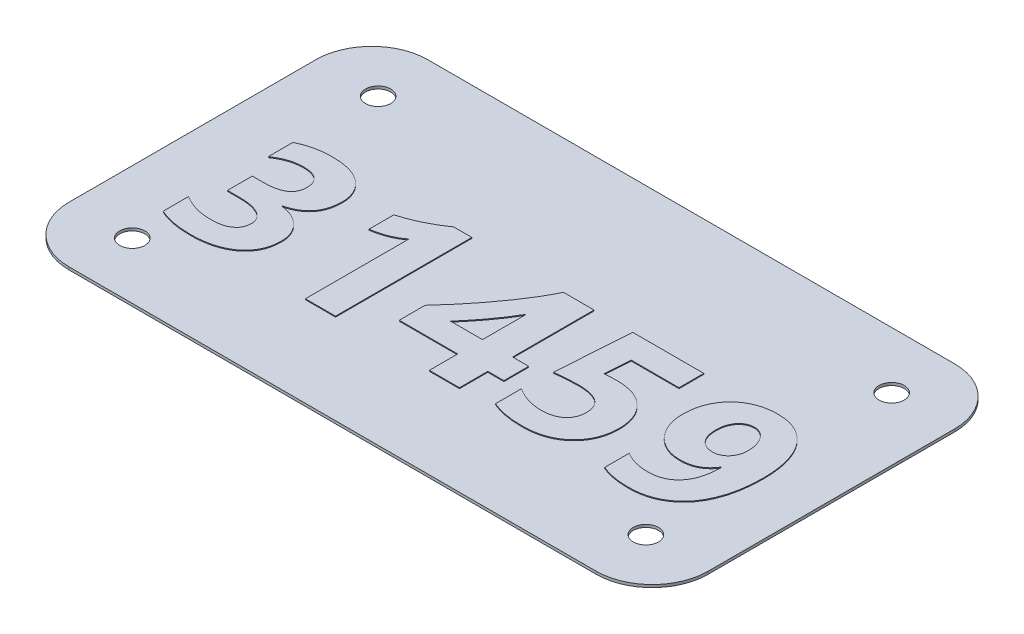
from build123d import *

# Parameters (mm, degrees)
SKETCH1_W               = 180.975
SKETCH1_H               = 101.6
BOSS_EXTRUDE1_DEPTH     = 0.762
F_1_4_CLEARANCE_HOLE1_D = 7.14248
FILLET1_R               = 15.875
BOSS_EXTRUDE2_DEPTH     = 0.254


with BuildPart() as part:
    # Sketch1 → Boss-Extrude1 (new body)
    with BuildSketch(Plane(origin=(0, 0, 0), x_dir=(1, 0, 0), z_dir=(0, 1, 0))):
        Rectangle(SKETCH1_W, SKETCH1_H)
    extrude(amount=BOSS_EXTRUDE1_DEPTH)

    # 1/4 Clearance Hole1 (through all)
    with Locations(Plane(origin=(0, 0.762, 0), x_dir=(1, 0, 0), z_dir=(0, 1, 0))):
        with Locations((-72.7075, 34.798), (72.7075, 34.798), (-72.7075, -34.798), (72.7075, -34.798)):
            Hole(F_1_4_CLEARANCE_HOLE1_D / 2)

    # Fillet1
    fillet1_edges = [part.edges().sort_by_distance(p)[0] for p in [
        (90.4875, 0.381, 50.8),
        (-90.4875, 0.381, 50.8),
        (90.4875, 0.381, -50.8),
        (-90.4875, 0.381, -50.8),
    ]]
    fillet(fillet1_edges, radius=FILLET1_R)

    # Sketch5 → Boss-Extrude2 (add)
    # profile 1 of 5: a face of its own
    with BuildSketch(Plane(origin=(0, 0.762, 0), x_dir=(1, 0, 0), z_dir=(0, 1, 0))):
        with BuildLine():
            Line((-74.696052632, -24.029214638), (-74.696052632, -16.877631579))
            add(Edge.make_bspline(
                [(-74.696052632, -16.877631579), (-74.378167624, -17.079146853), (-73.741541021, -17.482720413), (-72.728355023, -17.985019563), (-71.682669765, -18.420449341), (-70.597989217, -18.772580152), (-69.472304211, -19.048371267), (-68.306966145, -19.240864174), (-67.103186955, -19.362653315), (-66.28886388, -19.376958335), (-65.876027961, -19.384210526)],
                knots=[0, 0, 0, 0, 0.970358941, 1.943332655, 2.91275604, 3.890451204, 4.882084363, 5.899729618, 6.935229662, 8, 8, 8, 8], degree=3))
            add(Edge.make_bspline(
                [(-65.876027961, -19.384210526), (-65.617343819, -19.383005294), (-65.114805689, -19.380663925), (-64.386019459, -19.311012708), (-63.698732221, -19.224376492), (-63.058978898, -19.079648373), (-62.4585243, -18.908730338), (-61.899360437, -18.701042235), (-61.391554971, -18.438948898), (-60.923956317, -18.1503998), (-60.508555149, -17.821800031), (-60.147814763, -17.460057048), (-59.834719457, -17.072169298), (-59.584469, -16.649885737), (-59.395528706, -16.19233802), (-59.252385199, -15.710109841), (-59.176436707, -15.193257744), (-59.162436949, -14.841251664), (-59.155263158, -14.660875822)],
                knots=[0, 0, 0, 0, 1.341373837, 2.605847795, 3.795548442, 4.932806389, 6.004605022, 7.03360162, 8.021100945, 8.964503182, 9.880568904, 10.76181836, 11.610177664, 12.46048151, 13.298284203, 14.172844762, 15.063724513, 16, 16, 16, 16], degree=3))
            add(Edge.make_bspline(
                [(-59.155263158, -14.660875822), (-59.160637061, -14.475046103), (-59.171242716, -14.108302286), (-59.274303506, -13.574891115), (-59.447988248, -13.077185063), (-59.688292107, -12.613238268), (-59.993621766, -12.183121097), (-60.368663197, -11.786243204), (-60.811680573, -11.424346471), (-61.322406837, -11.100627567), (-61.8829128, -10.800562696), (-62.50280371, -10.553875119), (-63.16740468, -10.329228159), (-63.890720903, -10.165850495), (-64.657578788, -10.018230196), (-65.477759867, -9.932606992), (-66.344816526, -9.862901642), (-66.941159434, -9.860461311), (-67.246813322, -9.859210526)],
                knots=[0, 0, 0, 0, 0.848647978, 1.67484727, 2.471203628, 3.250476758, 4.055106015, 4.874033504, 5.738888827, 6.66243425, 7.634000352, 8.640132009, 9.708129545, 10.836999961, 12.026082463, 13.275438964, 14.603533866, 16, 16, 16, 16], degree=3))
            Line((-67.246813322, -9.859210526), (-70.685526316, -9.859210526))
            Line((-70.685526316, -9.859210526), (-70.685526316, -2.840789474))
            Line((-70.685526316, -2.840789474), (-67.473972039, -2.840789474))
            add(Edge.make_bspline(
                [(-67.473972039, -2.840789474), (-67.178773605, -2.839493075), (-66.605919328, -2.836977317), (-65.77769048, -2.769014018), (-65.003134266, -2.678458004), (-64.285581176, -2.547409988), (-63.625026526, -2.376685108), (-63.024354229, -2.165086372), (-62.479449512, -1.91223204), (-61.988170072, -1.628167327), (-61.554011208, -1.299297851), (-61.179886347, -0.933772877), (-60.858956208, -0.526896042), (-60.601501455, -0.080719548), (-60.403997427, 0.404864128), (-60.263909368, 0.925759759), (-60.176211546, 1.485353024), (-60.164116375, 1.871769695), (-60.157894737, 2.070538651)],
                knots=[0, 0, 0, 0, 1.41697016, 2.749734826, 3.987596193, 5.160581879, 6.249261069, 7.260463021, 8.214062335, 9.130079334, 9.980143092, 10.822404525, 11.635030293, 12.460800144, 13.287331072, 14.145034558, 15.04582392, 16, 16, 16, 16], degree=3))
            add(Edge.make_bspline(
                [(-60.157894737, 2.070538651), (-60.17189783, 2.432634787), (-60.198516832, 3.120956827), (-60.46673634, 4.084890908), (-60.923990217, 4.902050133), (-61.561213597, 5.571499019), (-62.383963909, 6.082453842), (-63.380348475, 6.432752079), (-64.54531355, 6.652973115), (-65.378827976, 6.673380028), (-65.821196546, 6.684210526)],
                knots=[0, 0, 0, 0, 1.03954698, 1.976113602, 2.846978632, 3.707421565, 4.605288891, 5.605470252, 6.729158527, 8, 8, 8, 8], degree=3))
            add(Edge.make_bspline(
                [(-65.821196546, 6.684210526), (-66.137507874, 6.676835959), (-66.767096506, 6.662157562), (-67.707530033, 6.538502167), (-68.640208315, 6.343662795), (-69.567454892, 6.067963868), (-70.488002339, 5.711632964), (-71.402965781, 5.282499691), (-72.310001434, 4.769264754), (-72.894313348, 4.377362688), (-73.192105263, 4.177631579)],
                knots=[0, 0, 0, 0, 0.95946577, 1.909728449, 2.873111488, 3.848248471, 4.841403439, 5.865672003, 6.912249423, 8, 8, 8, 8], degree=3))
            Line((-73.192105263, 4.177631579), (-73.192105263, 11.149054276))
            add(Edge.make_bspline(
                [(-73.192105263, 11.149054276), (-72.854460499, 11.312244231), (-72.17494028, 11.64066891), (-71.116876384, 12.064382367), (-70.013917793, 12.415734654), (-68.871564799, 12.707933141), (-67.684649295, 12.921106309), (-66.462361092, 13.090422286), (-65.196009906, 13.183354532), (-64.338276531, 13.195261029), (-63.902097039, 13.201315789)],
                knots=[0, 0, 0, 0, 0.936921025, 1.885581675, 2.845040147, 3.827732362, 4.829728537, 5.856733363, 6.910093765, 8, 8, 8, 8], degree=3))
            add(Edge.make_bspline(
                [(-63.902097039, 13.201315789), (-63.431841694, 13.194687911), (-62.51566556, 13.18177513), (-61.182830818, 13.056094094), (-59.92961182, 12.842793703), (-58.753856738, 12.558452174), (-57.658593068, 12.183883176), (-56.649740729, 11.714887413), (-55.711233142, 11.180023533), (-54.867715025, 10.547760926), (-54.104604634, 9.862466482), (-53.444490674, 9.114557447), (-52.880765704, 8.318167669), (-52.425801779, 7.467449256), (-52.069734372, 6.568642351), (-51.822181199, 5.618902037), (-51.656951776, 4.622056718), (-51.6427508, 3.938101665), (-51.635526316, 3.590152138)],
                knots=[0, 0, 0, 0, 1.286881394, 2.507169842, 3.659743542, 4.763861927, 5.814798697, 6.822061541, 7.80512612, 8.765644084, 9.701628403, 10.607893085, 11.490199644, 12.36629045, 13.242177191, 14.129735793, 15.048537555, 16, 16, 16, 16], degree=3))
            add(Edge.make_bspline(
                [(-51.635526316, 3.590152138), (-51.642094868, 3.281877472), (-51.654979748, 2.677165466), (-51.73964037, 1.791663178), (-51.889386935, 0.95157764), (-52.092293307, 0.157702542), (-52.350697675, -0.593303503), (-52.673583431, -1.301271988), (-53.054802751, -1.966153789), (-53.499916221, -2.581990539), (-53.995900962, -3.157792478), (-54.550316773, -3.69309384), (-55.176585409, -4.16911889), (-55.852524171, -4.607776822), (-56.581019563, -5.013839395), (-57.379826274, -5.348388163), (-58.223656593, -5.673179612), (-58.819264348, -5.830748635), (-59.123930921, -5.911348684)],
                knots=[0, 0, 0, 0, 1.119558741, 2.196127955, 3.226610043, 4.215550314, 5.169173875, 6.106967179, 7.03730018, 7.947802294, 8.862147662, 9.794363393, 10.740793978, 11.713924117, 12.719678096, 13.764328975, 14.856404703, 16, 16, 16, 16], degree=3))
            Line((-59.123930921, -5.911348684), (-59.123930921, -6.036677632))
            add(Edge.make_bspline(
                [(-59.123930921, -6.036677632), (-58.804531061, -6.081387724), (-58.177035473, -6.169225537), (-57.267973877, -6.382020678), (-56.411958982, -6.656197311), (-55.608573956, -6.987696584), (-54.85206024, -7.36805098), (-54.153699006, -7.820626398), (-53.49776518, -8.319720403), (-52.908197115, -8.884716252), (-52.371449265, -9.486500499), (-51.909280951, -10.131139679), (-51.51520941, -10.807547756), (-51.190503665, -11.518040281), (-50.941477383, -12.264168626), (-50.758516092, -13.042419349), (-50.658902824, -13.854107582), (-50.641654039, -14.404747995), (-50.632894737, -14.684375)],
                knots=[0, 0, 0, 0, 1.158484189, 2.275967552, 3.350109008, 4.385098635, 5.396383228, 6.388020822, 7.37141227, 8.353684064, 9.317544969, 10.265380317, 11.198755479, 12.126691483, 13.06725433, 14.020876979, 14.994958907, 16, 16, 16, 16], degree=3))
            add(Edge.make_bspline(
                [(-50.632894737, -14.684375), (-50.644775348, -15.105456337), (-50.667986141, -15.928110263), (-50.854089125, -17.127869735), (-51.146919728, -18.262869702), (-51.574844433, -19.330729873), (-52.125931091, -20.329479951), (-52.79685517, -21.260216324), (-53.589465166, -22.121101283), (-54.496530436, -22.907857367), (-55.510957871, -23.617367774), (-56.629375305, -24.222886493), (-57.829310485, -24.752566992), (-59.126442815, -25.174578825), (-60.512973363, -25.500434878), (-61.992247779, -25.733236802), (-63.562449609, -25.876213504), (-64.640701699, -25.892797387), (-65.194551809, -25.901315789)],
                knots=[0, 0, 0, 0, 0.974890006, 1.904613242, 2.805302594, 3.684642982, 4.561651009, 5.441157758, 6.335755588, 7.265950785, 8.217218773, 9.197029899, 10.207168093, 11.25138282, 12.351559227, 13.502922359, 14.717362352, 16, 16, 16, 16], degree=3))
            add(Edge.make_bspline(
                [(-65.194551809, -25.901315789), (-65.669868867, -25.894741791), (-66.600407156, -25.881871734), (-67.960138492, -25.797927774), (-69.251254418, -25.647711006), (-70.474807075, -25.444526767), (-71.633229139, -25.191904847), (-72.721206511, -24.867355191), (-73.741449745, -24.488815323), (-74.382243232, -24.180300516), (-74.696052632, -24.029214638)],
                knots=[0, 0, 0, 0, 1.167421023, 2.285484909, 3.344227258, 4.358431606, 5.330840848, 6.254046655, 7.144971691, 8, 8, 8, 8], degree=3))
        make_face()
    # profile 2 of 5: a face of its own
    with BuildSketch(Plane(origin=(0, 0.762, 0), x_dir=(1, 0, 0), z_dir=(0, 1, 0))):
        with BuildLine():
            Line((-24.564473684, 13.201315789), (-24.564473684, -25.4))
            Line((-24.564473684, -25.4), (-33.086842105, -25.4))
            Line((-33.086842105, -25.4), (-33.086842105, 3.926973684))
            add(Edge.make_bspline(
                [(-33.086842105, 3.926973684), (-33.333219812, 3.725190817), (-33.846709189, 3.304644005), (-34.727890555, 2.7738153), (-35.683040755, 2.264621977), (-36.711097657, 1.814114712), (-37.786835872, 1.412595835), (-38.901065417, 1.091295226), (-40.021154194, 0.824794232), (-40.775241599, 0.720061633), (-41.147060033, 0.668421053)],
                knots=[0, 0, 0, 0, 0.867170043, 1.807316953, 2.797597054, 3.817395315, 4.864647991, 5.925552493, 6.977150635, 8, 8, 8, 8], degree=3))
            Line((-41.147060033, 0.668421053), (-41.147060033, 7.686842105))
            add(Edge.make_bspline(
                [(-41.147060033, 7.686842105), (-40.610276899, 7.846528789), (-39.544658884, 8.163537643), (-37.98298232, 8.720841125), (-36.472986716, 9.350867229), (-35.007426593, 10.028833187), (-33.600087141, 10.768140185), (-32.248358698, 11.539936862), (-30.958969733, 12.346170432), (-30.139311967, 12.918506281), (-29.734292763, 13.201315789)],
                knots=[0, 0, 0, 0, 1.05507257, 2.094522473, 3.122346796, 4.137006178, 5.136016572, 6.11661462, 7.069358848, 8, 8, 8, 8], degree=3))
            Line((-29.734292763, 13.201315789), (-24.564473684, 13.201315789))
        make_face()
    # profile 3 of 5: a face of its own
    with BuildSketch(Plane(origin=(0, 0.762, 0), x_dir=(1, 0, 0), z_dir=(0, 1, 0))):
        with BuildLine():
            Line((10.527631579, 12.7), (10.527631579, -10.360526316))
            Line((10.527631579, -10.360526316), (15.07863898, -10.360526316))
            Line((15.07863898, -10.360526316), (15.07863898, -17.378947368))
            Line((15.07863898, -17.378947368), (10.527631579, -17.378947368))
            Line((10.527631579, -17.378947368), (10.527631579, -25.4))
            Line((10.527631579, -25.4), (2.005263158, -25.4))
            Line((2.005263158, -25.4), (2.005263158, -17.378947368))
            Line((2.005263158, -17.378947368), (-14.538157895, -17.378947368))
            Line((-14.538157895, -17.378947368), (-14.538157895, -10.070703125))
            add(Edge.make_bspline(
                [(-14.538157895, -10.070703125), (-14.16899834, -9.666902502), (-13.417974816, -8.845404688), (-12.291385658, -7.575074081), (-11.139708157, -6.253579328), (-9.580664417, -4.410541739), (-7.648346792, -2.035809889), (-5.427189459, 0.901383062), (-3.308580156, 3.877481201), (-1.660191141, 6.390348156), (-0.443839868, 8.395562516), (0.402778386, 9.854933726), (1.174724431, 11.283276103), (1.642601174, 12.233769778), (1.872101151, 12.7)],
                knots=[0, 0, 0, 0, 0.699455748, 1.422982866, 2.170670775, 2.940439431, 4.509133157, 6.084065357, 7.64750808, 9.178877586, 9.924827264, 10.6456774, 11.335686136, 12, 12, 12, 12], degree=3))
            Line((1.872101151, 12.7), (10.527631579, 12.7))
        make_face()
        with BuildLine():
            Line((-7.049753289, -10.360526316), (2.005263158, -10.360526316))
            Line((2.005263158, -10.360526316), (2.005263158, 2.070538651))
            add(Edge.make_bspline(
                [(2.005263158, 2.070538651), (1.68776863, 1.527829709), (1.04180349, 0.423649866), (-0.006244405, -1.208100485), (-1.113751026, -2.842395838), (-2.278633687, -4.447692181), (-3.474289855, -6.018313396), (-4.680754581, -7.531427859), (-5.866772889, -8.979946533), (-6.661659057, -9.907606681), (-7.049753289, -10.360526316)],
                knots=[0, 0, 0, 0, 0.979612454, 1.993091029, 3.021074493, 4.055414394, 5.083116047, 6.096545626, 7.070659807, 8, 8, 8, 8], degree=3))
        make_face(mode=Mode.SUBTRACT)
    # profile 4 of 5: a face of its own
    with BuildSketch(Plane(origin=(0, 0.762, 0), x_dir=(1, 0, 0), z_dir=(0, 1, 0))):
        with BuildLine():
            Line((19.551315789, -24.217208059), (19.551315789, -16.877631579))
            add(Edge.make_bspline(
                [(19.551315789, -16.877631579), (19.869704322, -17.078217653), (20.499470025, -17.474972612), (21.48122257, -17.980332648), (22.473441066, -18.417716207), (23.48501859, -18.769061085), (24.513787664, -19.044995353), (25.556084414, -19.239287459), (26.613778961, -19.362359357), (27.323984629, -19.37688666), (27.68203125, -19.384210526)],
                knots=[0, 0, 0, 0, 1.045911704, 2.068790963, 3.066919581, 4.058823823, 5.043260407, 6.025767562, 7.004700633, 8, 8, 8, 8], degree=3))
            add(Edge.make_bspline(
                [(27.68203125, -19.384210526), (27.946038194, -19.381051166), (28.459630388, -19.374905029), (29.204169648, -19.288510568), (29.90950285, -19.181082622), (30.563855722, -18.993926054), (31.183392861, -18.778779227), (31.754569261, -18.503096439), (32.283022233, -18.181611863), (32.763636364, -17.811215193), (33.192953349, -17.399585594), (33.565105364, -16.944949192), (33.887568636, -16.461989708), (34.149939347, -15.939054259), (34.34298695, -15.379469062), (34.484884828, -14.78669429), (34.571873711, -14.159496898), (34.584399561, -13.729019184), (34.590789474, -13.509416118)],
                knots=[0, 0, 0, 0, 1.235138331, 2.402805758, 3.506058287, 4.570643724, 5.58366338, 6.573254859, 7.53341862, 8.474722991, 9.408376946, 10.311442952, 11.220034871, 12.122024763, 13.042137439, 13.984948596, 14.972045588, 16, 16, 16, 16], degree=3))
            add(Edge.make_bspline(
                [(34.590789474, -13.509416118), (34.585316399, -13.281855152), (34.574635351, -12.837755687), (34.476054931, -12.195679933), (34.332717298, -11.590790086), (34.109231052, -11.035798808), (33.836423382, -10.519282305), (33.49299675, -10.05295079), (33.092771751, -9.626596815), (32.626357983, -9.251838009), (32.10313276, -8.916297907), (31.512582431, -8.640577157), (30.8661136, -8.396031893), (30.159292074, -8.192373578), (29.389007309, -8.037629669), (28.556740098, -7.929374195), (27.664660919, -7.868710494), (27.050254977, -7.858961718), (26.734231086, -7.853947368)],
                knots=[0, 0, 0, 0, 0.990512165, 1.933046467, 2.824010316, 3.692030824, 4.531645985, 5.361966227, 6.206726561, 7.071761607, 7.961490579, 8.907654635, 9.904674834, 10.9701181, 12.107663825, 13.323690576, 14.623421972, 16, 16, 16, 16], degree=3))
            add(Edge.make_bspline(
                [(26.734231086, -7.853947368), (26.232842756, -7.861695777), (25.192989912, -7.877765565), (23.575689899, -7.956931034), (21.849341012, -8.099398412), (20.663298236, -8.232104417), (20.052631579, -8.300431743)],
                knots=[0, 0, 0, 0, 0.898075267, 1.862560546, 2.899480666, 4, 4, 4, 4], degree=3))
            Line((20.052631579, -8.300431743), (21.486081414, 12.7))
            Line((21.486081414, 12.7), (41.609210526, 12.7))
            Line((41.609210526, 12.7), (41.609210526, 5.681578947))
            Line((41.609210526, 5.681578947), (28.097183388, 5.681578947))
            Line((28.097183388, 5.681578947), (27.572368421, -1.501336349))
            add(Edge.make_bspline(
                [(27.572368421, -1.501336349), (27.890863438, -1.477143205), (28.50672104, -1.430362155), (29.396948769, -1.37404254), (30.219673819, -1.340462483), (30.744730051, -1.338012051), (30.995415296, -1.336842105)],
                knots=[0, 0, 0, 0, 1.118133476, 2.162077785, 3.122494023, 4, 4, 4, 4], degree=3))
            add(Edge.make_bspline(
                [(30.995415296, -1.336842105), (31.458023024, -1.344494333), (32.357070816, -1.359365936), (33.666546947, -1.51417593), (34.898604845, -1.75351835), (36.05753782, -2.087980191), (37.135800364, -2.528579497), (38.137289567, -3.065800612), (39.068757418, -3.689762682), (39.904806398, -4.423996636), (40.658963255, -5.231445874), (41.320957739, -6.108141873), (41.869507124, -7.058599157), (42.329235589, -8.066680082), (42.682107116, -9.146804463), (42.926583679, -10.294480551), (43.092562282, -11.507166308), (43.106181238, -12.339097523), (43.113157895, -12.765275493)],
                knots=[0, 0, 0, 0, 1.177688029, 2.288759479, 3.35293289, 4.371414299, 5.355604968, 6.313566473, 7.261574922, 8.204297776, 9.140596028, 10.071565951, 10.99538363, 11.929861829, 12.888769151, 13.882684046, 14.915350935, 16, 16, 16, 16], degree=3))
            add(Edge.make_bspline(
                [(43.113157895, -12.765275493), (43.100939006, -13.238425193), (43.077016871, -14.164757478), (42.894662414, -15.521908479), (42.588257683, -16.809442116), (42.167709096, -18.037388778), (41.60241246, -19.188810099), (40.938438141, -20.287263389), (40.140165346, -21.31063208), (39.22280197, -22.254178113), (38.209799659, -23.116502133), (37.098264992, -23.865157154), (35.900132053, -24.489976571), (34.620407904, -25.015947914), (33.247311906, -25.407122071), (31.791473466, -25.698744769), (30.250315059, -25.873307433), (29.194266551, -25.891828704), (28.653330592, -25.901315789)],
                knots=[0, 0, 0, 0, 1.032038962, 2.020525452, 2.980772189, 3.915748445, 4.845661474, 5.773758265, 6.711506778, 7.670282466, 8.64032935, 9.608802813, 10.587242761, 11.583690301, 12.622013976, 13.696701294, 14.820189523, 16, 16, 16, 16], degree=3))
            add(Edge.make_bspline(
                [(28.653330592, -25.901315789), (28.211950137, -25.897502052), (27.344126334, -25.890003641), (26.071135382, -25.810502737), (24.850149517, -25.678708788), (23.684851862, -25.489373132), (22.569580297, -25.257872031), (21.510166962, -24.967504214), (20.505051416, -24.625336901), (19.865683758, -24.351734474), (19.551315789, -24.217208059)],
                knots=[0, 0, 0, 0, 1.13576838, 2.233100317, 3.280862839, 4.294967817, 5.27019338, 6.210774388, 7.120263257, 8, 8, 8, 8], degree=3))
        make_face()
    # profile 5 of 5: a face of its own
    with BuildSketch(Plane(origin=(0, 0.762, 0), x_dir=(1, 0, 0), z_dir=(0, 1, 0))):
        with BuildLine():
            add(Edge.make_bspline(
                [(75.698684211, -4.517064145), (75.685607227, -5.334744707), (75.660117299, -6.928584563), (75.448986366, -9.253623283), (75.087154241, -11.443390155), (74.602593349, -13.500164085), (73.964499264, -15.408519627), (73.209999705, -17.172971732), (72.312397204, -18.782581091), (71.284387663, -20.238703751), (70.129823184, -21.538766432), (68.850527762, -22.675031806), (67.453322164, -23.654812132), (65.936899736, -24.470356506), (64.308622002, -25.117913412), (62.571727964, -25.567331847), (60.73369949, -25.849438349), (59.472250728, -25.88374677), (58.826274671, -25.901315789)],
                knots=[0, 0, 0, 0, 1.27503111, 2.485317, 3.636714356, 4.733960776, 5.776955236, 6.770907333, 7.72247795, 8.645515542, 9.545340701, 10.427919496, 11.307911388, 12.200623559, 13.107231635, 14.03365798, 14.99305473, 16, 16, 16, 16], degree=3))
            add(Edge.make_bspline(
                [(58.826274671, -25.901315789), (58.43711873, -25.89697454), (57.671208282, -25.888430385), (56.542182195, -25.815895522), (55.454468181, -25.70104125), (54.406755919, -25.533692379), (53.399890218, -25.330236304), (52.439076386, -25.053926242), (51.514104475, -24.75828903), (50.92375903, -24.511251306), (50.632894737, -24.389535362)],
                knots=[0, 0, 0, 0, 1.113006314, 2.19054388, 3.234668403, 4.240261425, 5.224551845, 6.17040895, 7.098557104, 8, 8, 8, 8], degree=3))
            Line((50.632894737, -24.389535362), (50.632894737, -17.425945724))
            add(Edge.make_bspline(
                [(50.632894737, -17.425945724), (50.888641163, -17.584914024), (51.39846299, -17.901811938), (52.21771599, -18.291799933), (53.067589514, -18.629320553), (53.96150657, -18.902734501), (54.88921499, -19.12534263), (55.859402374, -19.267842917), (56.863313722, -19.367758634), (57.546614952, -19.378664052), (57.894140625, -19.384210526)],
                knots=[0, 0, 0, 0, 0.947035824, 1.887883792, 2.850758853, 3.822846903, 4.827422512, 5.850151059, 6.906591023, 8, 8, 8, 8], degree=3))
            add(Edge.make_bspline(
                [(57.894140625, -19.384210526), (58.247172077, -19.375928425), (58.935302943, -19.359784906), (59.93685146, -19.212463326), (60.88317487, -18.988811739), (61.77094413, -18.669536602), (62.595741631, -18.248612853), (63.357673178, -17.734793754), (64.069411891, -17.138236254), (64.711090591, -16.442520147), (65.294681141, -15.666526537), (65.796519559, -14.797760008), (66.218761881, -13.846381542), (66.560438648, -12.814021609), (66.836814352, -11.70436829), (67.028525987, -10.512160511), (67.146033743, -9.237495283), (67.166015271, -8.360745205), (67.176315789, -7.908778783)],
                knots=[0, 0, 0, 0, 1.012560329, 1.973688217, 2.898738545, 3.799464244, 4.67409931, 5.5490232, 6.431677773, 7.332964302, 8.259106493, 9.212698307, 10.205548637, 11.241027419, 12.329610542, 13.483856462, 14.702922962, 16, 16, 16, 16], degree=3))
            Line((67.176315789, -7.908778783), (67.019654605, -7.853947368))
            add(Edge.make_bspline(
                [(67.019654605, -7.853947368), (66.806034677, -8.173581987), (66.386813447, -8.800853138), (65.624124085, -9.621308507), (64.78177012, -10.313730248), (63.862077705, -10.88766363), (62.856546165, -11.328399326), (61.768368019, -11.638858901), (60.600731369, -11.831171971), (59.79572604, -11.853176278), (59.382421875, -11.864473684)],
                knots=[0, 0, 0, 0, 1.019202528, 2.000147374, 2.96033005, 3.906578951, 4.86856094, 5.864377534, 6.903533147, 8, 8, 8, 8], degree=3))
            add(Edge.make_bspline(
                [(59.382421875, -11.864473684), (59.000540862, -11.854551248), (58.248800746, -11.835018742), (57.147443509, -11.662311193), (56.086515668, -11.400650755), (55.080639206, -11.013833691), (54.129100163, -10.534482433), (53.238846908, -9.968199937), (52.416225477, -9.315933139), (51.656626701, -8.586546286), (50.986799902, -7.764761429), (50.377770619, -6.881085035), (49.861939882, -5.913508091), (49.413763654, -4.884071005), (49.060481066, -3.784930711), (48.814810396, -2.627336964), (48.649204412, -1.419947852), (48.634895401, -0.595879252), (48.627631579, -0.177549342)],
                knots=[0, 0, 0, 0, 1.031140037, 2.029818986, 3.005076421, 3.978546219, 4.934476443, 5.879700393, 6.823897111, 7.766801618, 8.718819317, 9.683456013, 10.661973825, 11.676277395, 12.713672655, 13.774970454, 14.870486742, 16, 16, 16, 16], degree=3))
            add(Edge.make_bspline(
                [(48.627631579, -0.177549342), (48.638973148, 0.308779051), (48.661256576, 1.264296126), (48.857439637, 2.663824374), (49.156880536, 4.001108962), (49.591084886, 5.268098699), (50.138160294, 6.454975157), (50.785942195, 7.562272671), (51.528712905, 8.58539098), (52.382763172, 9.512133644), (53.321864972, 10.352977451), (54.354487769, 11.092545322), (55.473257473, 11.729104556), (56.676944901, 12.263280301), (57.959405082, 12.686376518), (59.316861885, 12.980779938), (60.737685931, 13.165352972), (61.708265946, 13.189184669), (62.202323191, 13.201315789)],
                knots=[0, 0, 0, 0, 1.08942013, 2.14044574, 3.161074636, 4.156652875, 5.135897398, 6.085314516, 7.027508874, 7.963559392, 8.904371699, 9.847873501, 10.80449464, 11.784246069, 12.794607299, 13.82536837, 14.893040766, 16, 16, 16, 16], degree=3))
            add(Edge.make_bspline(
                [(62.202323191, 13.201315789), (62.712230844, 13.185515126), (63.710764368, 13.154573264), (65.170313566, 12.934054025), (66.548329919, 12.558667063), (67.842569643, 12.027799538), (69.051669628, 11.363836419), (70.168543125, 10.554630271), (71.187363795, 9.609843265), (72.117912219, 8.536253456), (72.949727882, 7.334527689), (73.672118519, 5.99850826), (74.288226698, 4.535988473), (74.805251377, 2.948509909), (75.208856783, 1.242816482), (75.497057202, -0.579386822), (75.670552656, -2.511007778), (75.689159118, -3.837831421), (75.698684211, -4.517064145)],
                knots=[0, 0, 0, 0, 0.97410218, 1.907548701, 2.812841071, 3.696654621, 4.574194298, 5.442381497, 6.324997419, 7.223265762, 8.15184693, 9.111793635, 10.119946768, 11.180119319, 12.298198425, 13.46530983, 14.702431543, 16, 16, 16, 16], degree=3))
        make_face()
        with BuildLine():
            add(Edge.make_bspline(
                [(66.855160362, -0.020888158), (66.841313535, 0.435114343), (66.814226024, 1.327157907), (66.525526679, 2.600570042), (66.118839923, 3.756944685), (65.630041791, 4.599590781), (65.173073219, 5.174508437), (64.803096145, 5.555962975), (64.393400866, 5.884094517), (63.954319906, 6.168749951), (63.483956964, 6.39723553), (62.988611803, 6.560013319), (62.47082365, 6.669776381), (62.116739624, 6.679332601), (61.935999178, 6.684210526)],
                knots=[0, 0, 0, 0, 1.772275661, 3.466970232, 5.058887229, 6.530350348, 7.232043703, 7.914930284, 8.594403737, 9.271134295, 9.948551618, 10.623600475, 11.297423641, 12, 12, 12, 12], degree=3))
            add(Edge.make_bspline(
                [(61.935999178, 6.684210526), (61.765896745, 6.677771739), (61.428747557, 6.66500983), (60.934736219, 6.575941928), (60.458872487, 6.437541913), (59.865854116, 6.160182357), (59.171477518, 5.703028876), (58.462174702, 4.973537507), (57.889417471, 4.071308871), (57.467847838, 3.023447602), (57.19399415, 1.851799231), (57.164898434, 1.032904107), (57.15, 0.613589638)],
                knots=[0, 0, 0, 0, 0.592522928, 1.17440192, 1.7443503, 2.314371299, 3.449938746, 4.620929955, 5.832367128, 7.150272159, 8.54079957, 10, 10, 10, 10], degree=3))
            add(Edge.make_bspline(
                [(57.15, 0.613589638), (57.155122513, 0.383704399), (57.16515397, -0.0664817), (57.225312218, -0.721626105), (57.335891854, -1.339965509), (57.537068269, -2.08996508), (57.891728439, -2.936308706), (58.470370287, -3.810491861), (59.213097515, -4.489082175), (60.072784152, -4.998469425), (61.06433434, -5.28830902), (61.759266419, -5.32732907), (62.116159539, -5.347368421)],
                knots=[0, 0, 0, 0, 0.787897938, 1.542946819, 2.252058915, 2.937982863, 4.201072688, 5.379960299, 6.500772121, 7.619581854, 8.777499434, 10, 10, 10, 10], degree=3))
            add(Edge.make_bspline(
                [(62.116159539, -5.347368421), (62.291400628, -5.343690479), (62.633316562, -5.336514382), (63.133073425, -5.255849516), (63.604923886, -5.121013692), (64.198686582, -4.883007727), (64.87519412, -4.466001882), (65.568470313, -3.811132115), (66.126970173, -3.018885416), (66.543921359, -2.106631311), (66.808427746, -1.092886845), (66.83938209, -0.382825668), (66.855160362, -0.020888158)],
                knots=[0, 0, 0, 0, 0.660216904, 1.288160679, 1.902058209, 2.507131373, 3.695704446, 4.872601868, 6.079902061, 7.326418051, 8.637202506, 10, 10, 10, 10], degree=3))
        make_face(mode=Mode.SUBTRACT)
    extrude(amount=BOSS_EXTRUDE2_DEPTH)


solid = part.part
